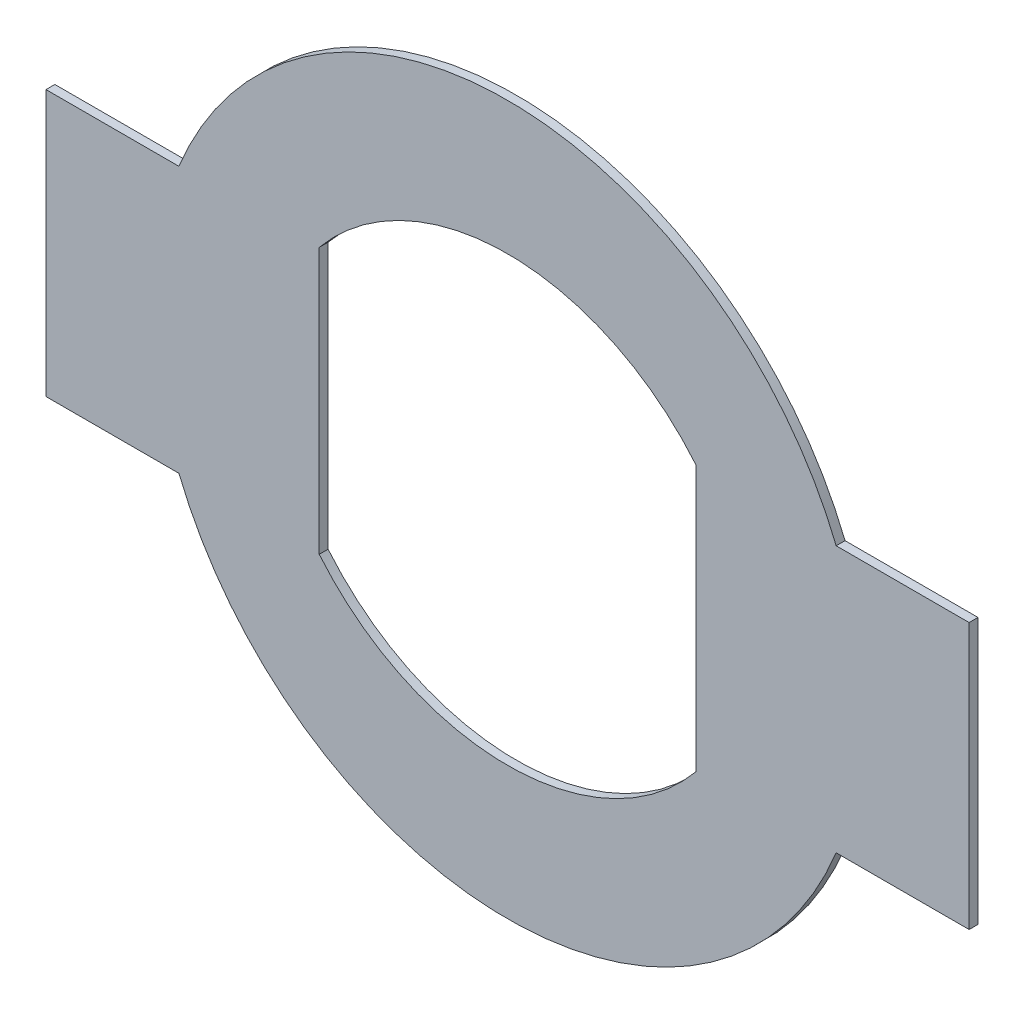
from build123d import *

# Parameters (mm, degrees)
BASE_FLANGE1_DEPTH = 0.2


# Sheet-metal steps are written as plain solids
with BuildPart() as part:
    # Sketch1 → Base-Flange1 (new body)
    with BuildSketch(Plane.XY):
        with BuildLine():
            Line((7.416198487, 3), (10.416198487, 3))
            Line((10.416198487, 3), (10.416198487, -3))
            Line((10.416198487, -3), (7.416198487, -3))
            ThreePointArc((7.416198487, -3), (0, -8), (-7.416198487, -3))
            Line((-7.416198487, -3), (-10.416198487, -3))
            Line((-10.416198487, -3), (-10.416198487, 3))
            Line((-10.416198487, 3), (-7.416198487, 3))
            ThreePointArc((-7.416198487, 3), (0, 8), (7.416198487, 3))
        make_face()
        with BuildLine():
            Line((-4.25, 3), (-4.25, -3))
            ThreePointArc((-4.25, -3), (0, -5), (4.25, -3))
            Line((4.25, -3), (4.25, 3))
            ThreePointArc((4.25, 3), (0, 5), (-4.25, 3))
        make_face(mode=Mode.SUBTRACT)
    extrude(amount=-BASE_FLANGE1_DEPTH)


solid = part.part
